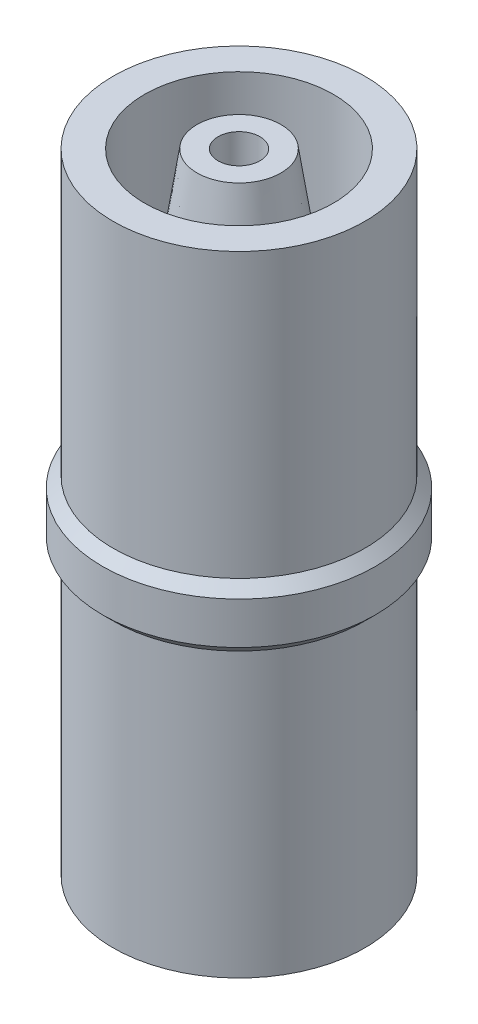
from build123d import *


with BuildPart() as part:
    # Sketch1 → Revolve1 (revolve)
    with BuildSketch(Plane.XY):
        Polygon((1, 30), (2, 30), (2.5, 26.666666667), (2, 26.666666667), (2.5, 23.333333333), (2, 23.333333333), (2.5, 20), (2, 20), (2, 16.5), (4.5, 16.5), (4.5, 30), (6, 30), (6, 16.5), (6.5, 16), (6.5, 14), (6, 13.5), (6, 0), (4.5, 0), (4.5, 13.5), (2, 13.5), (2, 11.153784026), (1.5, 10), (2, 10), (1.5, 6.666666667), (2, 6.666666667), (1.5, 3.333333333), (2, 3.333333333), (1.5, 0), (1, 0), (0.7, 0), (0.7, 10.214359354), (1, 11.333974596), align=None)
    revolve(axis=Axis((0, 30, 0), (0, -1, 0)))


solid = part.part
